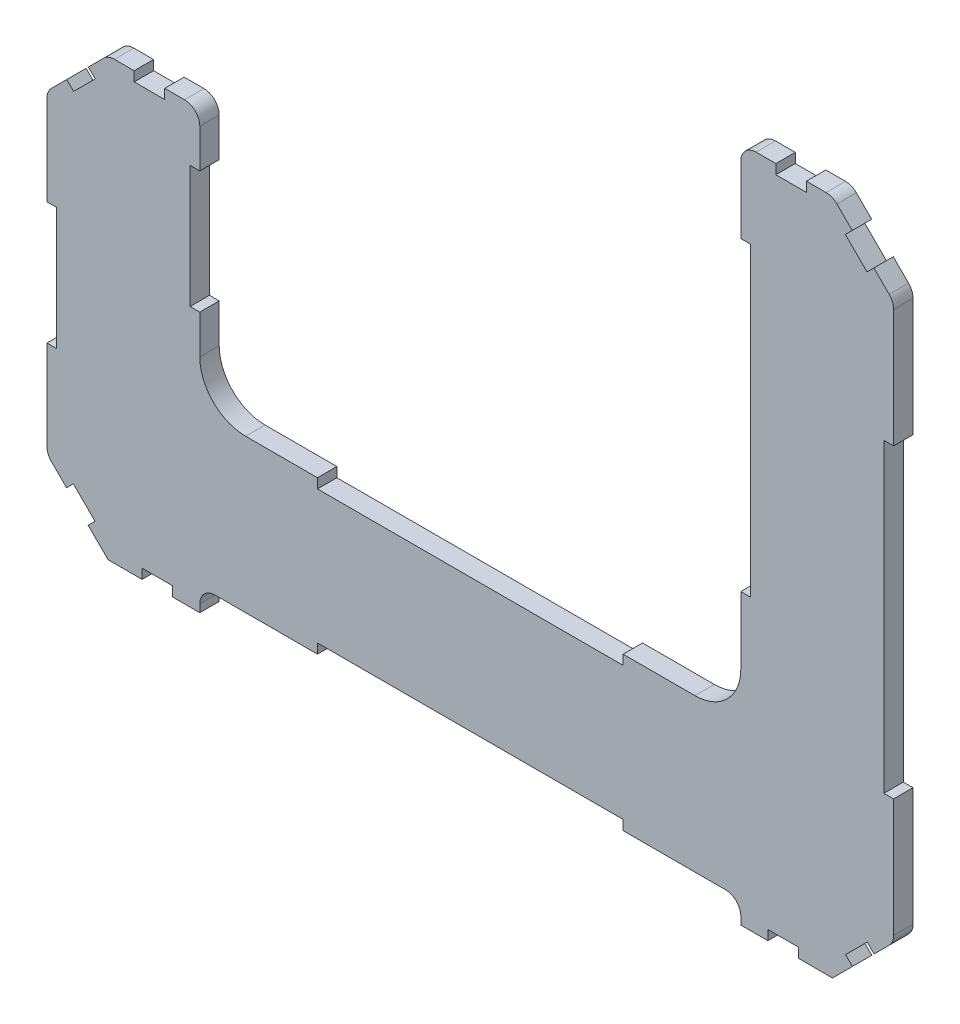
from build123d import *

# Parameters (mm, degrees)
BOSS_EXTRUDE1_DEPTH      = 3.175
BOSS_EXTRUDE1_DEPTH_BACK = 3.175
CHAMFER1_SIZE            = 20
FILLET1_R                = 15
FILLET2_R                = 5
SKETCH4_W                = 10
SKETCH4_H                = 3.175
SKETCH4_W_2              = 3.175
SKETCH4_H_2              = 100
SKETCH4_W_3              = 100
SKETCH4_H_3              = 40
WALL_SLOTS_DEPTH         = 60


with BuildPart() as part:
    # Sketch2 → Boss-Extrude1 (new, two sides: drawn at the far end of the back side and taken through both)
    with BuildSketch(Plane.XY.offset(-BOSS_EXTRUDE1_DEPTH_BACK)):
        Polygon((-138.5, 85.338455572), (-88.5, 85.338455572), (-88.5, 0), (88.5, 0), (88.5, 164), (138.5, 164), (138.5, -57.5), (88.5, -57.5), (88.5, -50), (-88.5, -50), (-88.5, -57.5), (-138.5, -57.5), align=None)
    extrude(amount=BOSS_EXTRUDE1_DEPTH + BOSS_EXTRUDE1_DEPTH_BACK)

    # Chamfer1
    chamfer1_edges = [part.edges().sort_by_distance(p)[0] for p in [
        (-138.5, -57.5, 0),
        (138.5, -57.5, 0),
        (138.5, 164, 0),
        (-138.5, 85.338455572, 0),
    ]]
    chamfer(chamfer1_edges, length=CHAMFER1_SIZE)

    # Fillet1
    fillet1_edges = [part.edges().sort_by_distance(p)[0] for p in [
        (88.5, 0, 0),
        (-88.5, 0, 0),
    ]]
    fillet(fillet1_edges, radius=FILLET1_R)

    # Fillet2
    fillet2_edges = [part.edges().sort_by_distance(p)[0] for p in [
        (138.5, -37.5, 0),
        (88.5, -50, 0),
        (-88.5, -50, 0),
        (-138.5, -37.5, 0),
        (-138.5, 65.338455572, 0),
        (-118.5, 85.338455572, 0),
        (-88.5, 85.338455572, 0),
        (138.5, 144, 0),
        (118.5, 164, 0),
        (88.5, 164, 0),
    ]]
    fillet(fillet2_edges, radius=FILLET2_R)

    # Sketch4 → wall_slots (cut)
    with BuildSketch(Plane.XY.offset(3.175)):
        with Locations((104.964466094, 162.4125)):
            Rectangle(SKETCH4_W, SKETCH4_H)
        Polygon((132.035533906, 150.464466094), (124.964466094, 157.535533906), (122.719402064, 155.290469876), (129.790469876, 148.219402064), align=None)
        with Locations((90.0875, 87)):
            Rectangle(SKETCH4_W_2, SKETCH4_H_2)
        with Locations((136.9125, 53.25)):
            Rectangle(SKETCH4_W_2, SKETCH4_H_2)
        with Locations((0, -1.5875)):
            Rectangle(SKETCH4_W_3, SKETCH4_H)
        with Locations((0, -48.4125)):
            Rectangle(SKETCH4_W_3, SKETCH4_H)
        with Locations((-136.9125, 13.919227786)):
            Rectangle(SKETCH4_W_2, SKETCH4_H_3)
        Polygon((-124.964466094, 78.873989478), (-132.035533906, 71.802921666), (-129.790469876, 69.557857636), (-122.719402064, 76.628925448), align=None)
        with Locations((-104.964466094, 83.750955572)):
            Rectangle(SKETCH4_W, SKETCH4_H)
        with Locations((-90.0875, 47.669227786)):
            Rectangle(SKETCH4_W_2, SKETCH4_H_3)
        Polygon((-132.098795988, -43.901204012), (-125.027728176, -50.972271824), (-122.782664146, -48.727207794), (-129.853731957, -41.656139982), align=None)
        with Locations((-102.375, -55.9125)):
            Rectangle(SKETCH4_W, SKETCH4_H)
        Polygon((122.782664146, -48.727207794), (125.027728176, -50.972271824), (132.098795988, -43.901204012), (129.853731957, -41.656139982), align=None)
        with Locations((102.375, -55.9125)):
            Rectangle(SKETCH4_W, SKETCH4_H)
    extrude(amount=-WALL_SLOTS_DEPTH, mode=Mode.SUBTRACT)


solid = part.part
